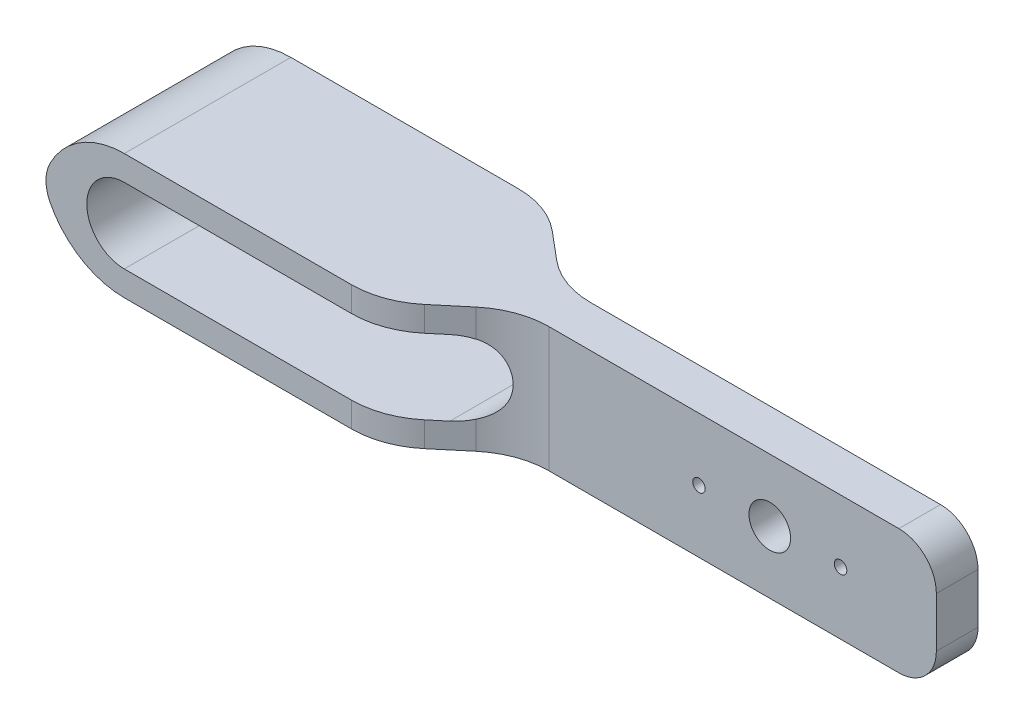
from build123d import *

# Parameters (mm, degrees)
ESBO_O1_W                         = 40
ESBO_O1_H                         = 15
RESSALTO_EXTRUS_O1_DEPTH          = 3
ESBO_O3_W                         = 40
ESBO_O3_H                         = 15
RESSALTO_EXTRUS_O2_DEPTH          = 2
CORTE_EXTRUS_O1_REACH             = 26.418
ESBO_O2_R                         = 2.5
ESBO_O2_R_2                       = 0.75
CORTE_EXTRUS_O1_DIRECTION_2_REACH = 26.418
ESBO_O5_W                         = 20
ESBO_O5_H                         = 15
RESSALTO_EXTRUS_O4_DEPTH          = 60
CHANFRO1_SIZE                     = 19.068057482
CHANFRO1_SIZE_2                   = 16
FILETE4_R                         = 10
ESBO_O6_W                         = 12.577854287
ESBO_O6_H                         = 9
CORTE_EXTRUS_O2_DEPTH             = 81.237970309
FILETE5_R                         = 4.5
CIRPATTERN1_COUNT                 = 2
FILLET1_R                         = 4.5


# Some blends are built 0.0001 mm under size
with BuildPart() as part:
    # Esboço1 → Ressalto-extrusão1 (new body)
    with BuildSketch(Plane.XY):
        with Locations((2.5, 1.5)):
            Rectangle(ESBO_O1_W, ESBO_O1_H)
    extrude(amount=-RESSALTO_EXTRUS_O1_DEPTH)

    # Esboço3 → Ressalto-extrusão2 (add)
    with BuildSketch(Plane.XY):
        with Locations((2.5, 1.5)):
            Rectangle(ESBO_O3_W, ESBO_O3_H)
    extrude(amount=RESSALTO_EXTRUS_O2_DEPTH)

    # Corte-extrusão1: up to this face of the body (flat: up to its plane)
    corte_extrus_o1_end = Plane(part.part.faces().sort_by_distance((2.5, 1.5, 2))[0])
    # Esboço2 → Corte-extrusão1 (cut, up to the picked face)
    with BuildSketch(Plane.XY, mode=Mode.PRIVATE) as corte_extrus_o1_sk1:
        with Locations(Location((2.5, 1.5, 0), (0, 0, 180))):
            Circle(ESBO_O2_R)
    corte_extrus_o1_tool1 = split(extrude(corte_extrus_o1_sk1.sketch, amount=CORTE_EXTRUS_O1_REACH, mode=Mode.PRIVATE), bisect_by=corte_extrus_o1_end, keep=Keep.BOTH, mode=Mode.PRIVATE)
    # Esboço2 → Corte-extrusão1 (cut, up to the picked face)
    with BuildSketch(Plane.XY, mode=Mode.PRIVATE) as corte_extrus_o1_sk2:
        with Locations(Location((-6, 1.5, 0), (0, 0, 180))):
            Circle(ESBO_O2_R_2)
    corte_extrus_o1_tool2 = split(extrude(corte_extrus_o1_sk2.sketch, amount=CORTE_EXTRUS_O1_REACH, mode=Mode.PRIVATE), bisect_by=corte_extrus_o1_end, keep=Keep.BOTH, mode=Mode.PRIVATE)
    corte_extrus_o1_1 = corte_extrus_o1_tool1.solids().sort_by(Axis((2.5, 1.5, 0), (0, 0, 1)))[0]
    add(corte_extrus_o1_1, mode=Mode.SUBTRACT)
    corte_extrus_o1_2 = corte_extrus_o1_tool2.solids().sort_by(Axis((-6, 1.5, 0), (0, 0, 1)))[0]
    add(corte_extrus_o1_2, mode=Mode.SUBTRACT)
    corte_extrus_o1 = corte_extrus_o1_1 + corte_extrus_o1_2  # Corte-extrusão1 as one shape, for the pattern or mirror that repeats it

    # Corte-extrusão1 direction 2: up to this face of the body (flat: up to its plane)
    corte_extrus_o1_direction_2_end = Plane(part.part.faces().sort_by_distance((2.5, 1.5, -3))[0])
    # Esboço2 → Corte-extrusão1 direction 2 (cut, up to the picked face)
    with BuildSketch(Plane.XY, mode=Mode.PRIVATE) as corte_extrus_o1_direction_2_sk1:
        with Locations(Location((2.5, 1.5, 0), (0, 0, 180))):
            Circle(ESBO_O2_R)
    corte_extrus_o1_direction_2_tool1 = split(extrude(corte_extrus_o1_direction_2_sk1.sketch, amount=-CORTE_EXTRUS_O1_DIRECTION_2_REACH, mode=Mode.PRIVATE), bisect_by=corte_extrus_o1_direction_2_end, keep=Keep.BOTH, mode=Mode.PRIVATE)
    # Esboço2 → Corte-extrusão1 direction 2 (cut, up to the picked face)
    with BuildSketch(Plane.XY, mode=Mode.PRIVATE) as corte_extrus_o1_direction_2_sk2:
        with Locations(Location((-6, 1.5, 0), (0, 0, 180))):
            Circle(ESBO_O2_R_2)
    corte_extrus_o1_direction_2_tool2 = split(extrude(corte_extrus_o1_direction_2_sk2.sketch, amount=-CORTE_EXTRUS_O1_DIRECTION_2_REACH, mode=Mode.PRIVATE), bisect_by=corte_extrus_o1_direction_2_end, keep=Keep.BOTH, mode=Mode.PRIVATE)
    corte_extrus_o1_direction_2_1 = corte_extrus_o1_direction_2_tool1.solids().sort_by(Axis((2.5, 1.5, 0), (0, 0, -1)))[0]
    add(corte_extrus_o1_direction_2_1, mode=Mode.SUBTRACT)
    corte_extrus_o1_direction_2_2 = corte_extrus_o1_direction_2_tool2.solids().sort_by(Axis((-6, 1.5, 0), (0, 0, -1)))[0]
    add(corte_extrus_o1_direction_2_2, mode=Mode.SUBTRACT)
    corte_extrus_o1_direction_2 = corte_extrus_o1_direction_2_1 + corte_extrus_o1_direction_2_2  # Corte-extrusão1 direction 2 as one shape, for the pattern or mirror that repeats it

    # Esboço5 → Ressalto-extrusão4 (add)
    with BuildSketch(Plane.ZY.offset(17.5)):
        with Locations((-0.5, 1.5)):
            Rectangle(ESBO_O5_W, ESBO_O5_H)
    extrude(amount=RESSALTO_EXTRUS_O4_DEPTH)

    # Chanfro1
    # the kernel refuses this chamfer: 19.068057482, 16 mm, written as the material it takes off along each edge
    with BuildSketch(Plane(origin=(-17.5, 58.146127732, -10.5), x_dir=(-0.9996889667359941, 0, -0.024939322090234247), z_dir=(0, -1, 0))) as chanfro1_piece_1_section:
        Polygon((CHANFRO1_SIZE * 0.99968896671, -CHANFRO1_SIZE * 0.0249393220896), (-CHANFRO1_SIZE_2 * 0.0249393220902, -CHANFRO1_SIZE_2 * 0.999688966736), (0, 0), align=None)
    chanfro1_piece_1 = extrude(amount=113.292255464, mode=Mode.PRIVATE)
    chanfro1_piece_1 = split(chanfro1_piece_1, bisect_by=Plane(origin=(-25.155035178, 1.5, -3), z_dir=(0, 0, -1)), keep=Keep.TOP, mode=Mode.PRIVATE)
    add(chanfro1_piece_1, mode=Mode.SUBTRACT)
    with BuildSketch(Plane(origin=(-17.5, 58.146127732, -10.5), x_dir=(-0.9996889667359941, 0, -0.024939322090234247), z_dir=(0, -1, 0))) as chanfro1_piece_2_section:
        Polygon((CHANFRO1_SIZE * 0.99968896671, -CHANFRO1_SIZE * 0.0249393220896), (-CHANFRO1_SIZE_2 * 0.0249393220902, -CHANFRO1_SIZE_2 * 0.999688966736), (0, 0), align=None)
    chanfro1_piece_2 = extrude(amount=113.292255464, mode=Mode.PRIVATE)
    chanfro1_piece_2 = split(chanfro1_piece_2, bisect_by=Plane(origin=(-18.373305927, 1.5, 2), z_dir=(0, 0, 1)), keep=Keep.TOP, mode=Mode.PRIVATE)
    add(chanfro1_piece_2, mode=Mode.SUBTRACT)
    with BuildSketch(Plane(origin=(-17.5, -55.146127732, 9.5), x_dir=(-0.9996889667359941, 0, 0.024939322090234247), z_dir=(0, 1, 0))) as chanfro1_piece_3_section:
        Polygon((CHANFRO1_SIZE * 0.99968896671, -CHANFRO1_SIZE * 0.0249393220896), (-CHANFRO1_SIZE_2 * 0.0249393220902, -CHANFRO1_SIZE_2 * 0.999688966736), (0, 0), align=None)
    chanfro1_piece_3 = extrude(amount=113.292255464, mode=Mode.PRIVATE)
    chanfro1_piece_3 = split(chanfro1_piece_3, bisect_by=Plane(origin=(-25.155035178, 1.5, 2), z_dir=(0, 0, 1)), keep=Keep.TOP, mode=Mode.PRIVATE)
    add(chanfro1_piece_3, mode=Mode.SUBTRACT)
    with BuildSketch(Plane(origin=(-17.5, -55.146127732, 9.5), x_dir=(-0.9996889667359941, 0, 0.024939322090234247), z_dir=(0, 1, 0))) as chanfro1_piece_4_section:
        Polygon((CHANFRO1_SIZE * 0.99968896671, -CHANFRO1_SIZE * 0.0249393220896), (-CHANFRO1_SIZE_2 * 0.0249393220902, -CHANFRO1_SIZE_2 * 0.999688966736), (0, 0), align=None)
    chanfro1_piece_4 = extrude(amount=113.292255464, mode=Mode.PRIVATE)
    chanfro1_piece_4 = split(chanfro1_piece_4, bisect_by=Plane(origin=(-18.373305927, 1.5, -3), z_dir=(0, 0, -1)), keep=Keep.TOP, mode=Mode.PRIVATE)
    add(chanfro1_piece_4, mode=Mode.SUBTRACT)

    # Filete4
    # the kernel refuses this fillet: 10 mm, written as the material it adds along each edge
    with BuildSketch(Plane(origin=(-27.629905537, 9, -3), x_dir=(1, 0, 0), z_dir=(0, -1, 0)), Plane(origin=(-27.629905537, -6, 2), x_dir=(1, 0, 0), z_dir=(0, 1, 0))) as filete4_piece_1:
        with BuildLine():
            CenterArc((FILETE4_R * 0.363970234266, -FILETE4_R), FILETE4_R, 90, 40)
            Line((-FILETE4_R * 0.27881737542, -FILETE4_R * 0.233955556881), (0, 0))
            Line((0, 0), (FILETE4_R * 0.363970234266, 0))
        make_face()
    extrude(amount=15)
    # the kernel refuses this fillet: 10 mm, written as the material it takes off along each edge
    with BuildSketch(Plane(origin=(-77.5, 9, 34.5), x_dir=(0, -1, 0), z_dir=(0, 0, -1))) as filete4_2_piece_1:
        with BuildLine():
            CenterArc((FILETE4_R, -FILETE4_R), FILETE4_R, 90, 90)
            Line((0, -FILETE4_R), (0, 0))
            Line((0, 0), (FILETE4_R, 0))
        make_face()
    extrude(amount=70, mode=Mode.SUBTRACT)
    with BuildSketch(Plane(origin=(-77.5, -6, -35.5), x_dir=(1, 0, 0), z_dir=(0, 0, 1))) as filete4_2_piece_2:
        with BuildLine():
            CenterArc((FILETE4_R, FILETE4_R), FILETE4_R, 180, 90)
            Line((0, FILETE4_R), (0, 0))
            Line((0, 0), (FILETE4_R, 0))
        make_face()
    extrude(amount=70, mode=Mode.SUBTRACT)
    with BuildSketch(Plane(origin=(-36.568057482, 18.099255857, -10.5), x_dir=(0.7660444431190706, 0, 0.6427876096864291), z_dir=(0, -1, 0))) as filete4_2_piece_3:
        with BuildLine():
            CenterArc((FILETE4_R * 0.363970234266, FILETE4_R), FILETE4_R, 230, 40)
            Line((-FILETE4_R * 0.27881737542, FILETE4_R * 0.233955556881), (0, 0))
            Line((0, 0), (FILETE4_R * 0.363970234266, 0))
        make_face()
    extrude(amount=33.198511713, mode=Mode.SUBTRACT)
    with BuildSketch(Plane(origin=(-36.568057482, -15.099255857, 9.5), x_dir=(-1, 0, 0), z_dir=(0, 1, 0))) as filete4_2_piece_4:
        with BuildLine():
            CenterArc((FILETE4_R * 0.363970234266, -FILETE4_R), FILETE4_R, 90, 40)
            Line((-FILETE4_R * 0.27881737542, -FILETE4_R * 0.233955556881), (0, 0))
            Line((0, 0), (FILETE4_R * 0.363970234266, 0))
        make_face()
    extrude(amount=33.198511713, mode=Mode.SUBTRACT)

    # Esboço6 → Corte-extrusão2 (cut, through all)
    with BuildSketch(Plane.XY.offset(9.5)):
        with BuildLine():
            Line((-40.207759824, 6), (-43.207759824, 6))
            Line((-43.207759824, 6), (-67.5, 6))
            ThreePointArc((-67.5, 6), (-71.468626967, 4.766281297), (-74.038348415, 1.5))
            ThreePointArc((-74.038348415, 1.5), (-71.468626967, -1.766281297), (-67.5, -3))
            Line((-67.5, -3), (-43.207759824, -3))
            Line((-43.207759824, -3), (-40.207759824, -3))
            Line((-40.207759824, -3), (-40.207759824, 6))
        make_face()
        with Locations((-33.918832681, 1.5)):
            Rectangle(ESBO_O6_W, ESBO_O6_H)
    extrude(amount=-CORTE_EXTRUS_O2_DEPTH, mode=Mode.SUBTRACT)

    # Filete5
    filete5_edges = [part.edges().sort_by_distance(p)[0] for p in [
        (-27.629905537, -3, -0.5),
        (-27.629905537, 6, -0.5),
        (22.5, -6, -0.5),
        (22.5, 9, -0.5),
    ]]
    fillet(filete5_edges, radius=FILETE5_R - 0.0001)  # a hair under: the kernel refuses the full size

    # CirPattern1: Corte-extrusão1, Corte-extrusão1 direction 2 ×2 about axis
    cirpattern1_axis = Axis((2.5, 1.5, 0), (0, 0, 1))
    add([corte_extrus_o1.rotate(cirpattern1_axis, i * 360 / CIRPATTERN1_COUNT) for i in range(1, CIRPATTERN1_COUNT)], mode=Mode.SUBTRACT)
    add([corte_extrus_o1_direction_2.rotate(cirpattern1_axis, i * 360 / CIRPATTERN1_COUNT) for i in range(1, CIRPATTERN1_COUNT)], mode=Mode.SUBTRACT)

    # Fillet1
    # the kernel refuses this fillet: 4.5 mm, written as the material it adds along each edge
    with BuildSketch(Plane(origin=(-74.038348415, 1.5, 9.5), x_dir=(0.8237540050665563, -0.566947386568461, 0), z_dir=(0, 0, -1))) as fillet1_piece_1:
        with BuildLine():
            CenterArc((5.385987308, -3.706897217), FILLET1_R, 55.462463306, 179.999811631)
            ThreePointArc((2.834717975, -7.413786046), (0.265006635, -4.147503786), (0, 0))
            ThreePointArc((0, 0), (3.968622227, 1.233715441), (7.937244454, 0))
        make_face()
    extrude(amount=20)
    # the kernel refuses this fillet: 4.5 mm, written as the material it takes off along each edge
    with BuildSketch(Plane(origin=(-77.182458366, 1.5, -15.968577797), x_dir=(0.3543987879296305, 0.9350943797895531, 0), z_dir=(0, 0, 1))) as fillet1_2_piece_1:
        with BuildLine():
            CenterArc((1.695259117, -4.473004216), FILLET1_R, 83.720910198, 54.071383579)
            ThreePointArc((-1.63795498, -1.449813223), (-0.858738838, -0.679985448), (0, 0))
            ThreePointArc((0, 0), (1.093715559, 0.05999063), (2.187431119, 0))
        make_face()
    extrude(amount=30.937155594, mode=Mode.SUBTRACT)


with BuildPart() as part_1:
    # Body-Move/Copy2: moved
    add(part.part.moved(Location((0, 0, 1))))


solid = part_1.part
